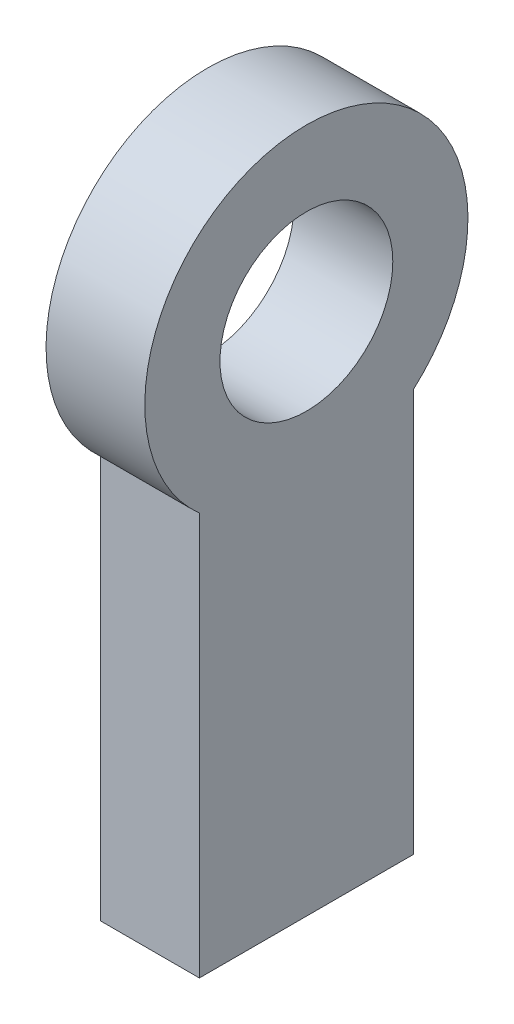
from build123d import *

# Parameters (mm, degrees)
SKETCH_1_R             = 5.25
SM_BASE_FLANGE_1_DEPTH = 6


# Sheet-metal steps are written as plain solids
with BuildPart() as part:
    # Sketch 1 → Базовая кромка1 (new body)
    with BuildSketch(Plane(origin=(0, 0, 0), x_dir=(0, 0, -1), z_dir=(1, 0, 0))):
        with BuildLine():
            Line((-6.5, -31.814954576), (6.5, -31.814954576))
            Line((6.5, -31.814954576), (6.5, -7.354137158))
            ThreePointArc((6.5, -7.354137158), (0, 9.814954576), (-6.5, -7.354137158))
            Line((-6.5, -7.354137158), (-6.5, -31.814954576))
        make_face()
        Circle(SKETCH_1_R, mode=Mode.SUBTRACT)
    extrude(amount=SM_BASE_FLANGE_1_DEPTH)


solid = part.part
